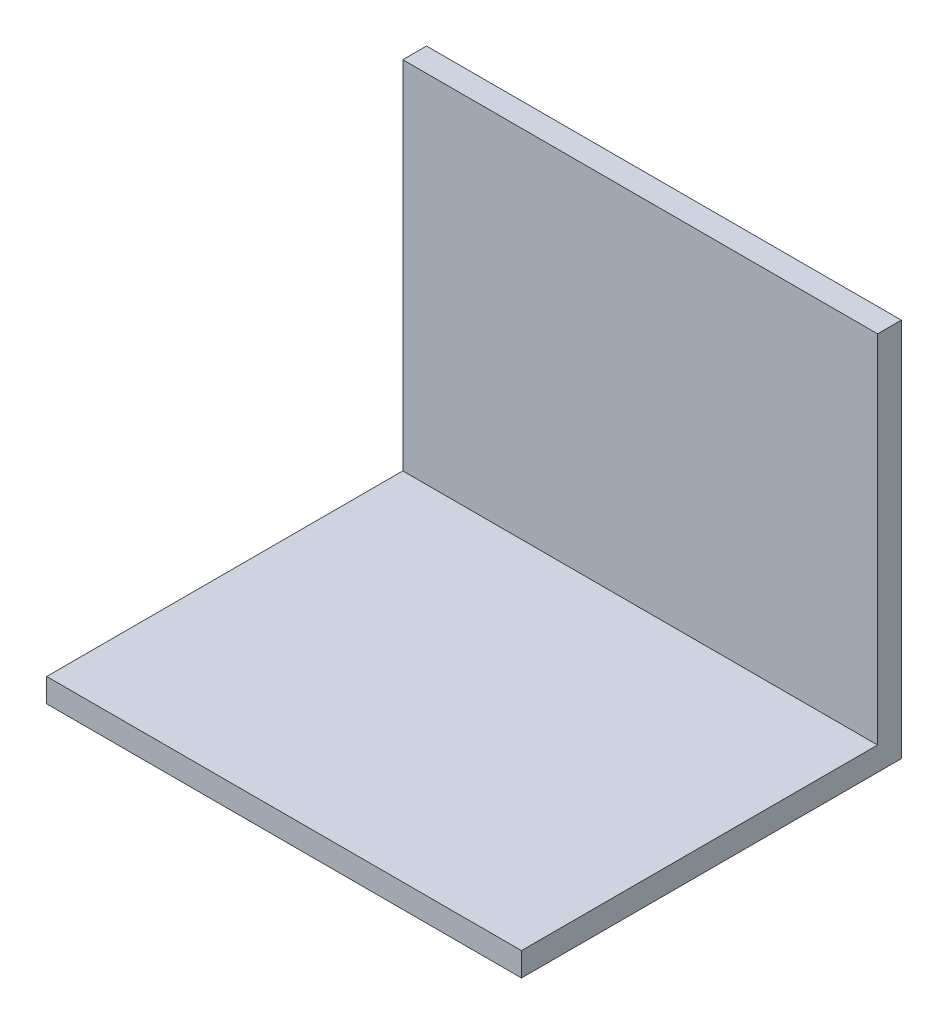
from build123d import *

# Parameters (mm, degrees)
BOSS_EXTRUDE1_DEPTH = 63.5


with BuildPart() as part:
    # Sketch1 → Boss-Extrude1 (new body)
    with BuildSketch(Plane(origin=(0, 0, 0), x_dir=(0, 0, -1), z_dir=(1, 0, 0))):
        Polygon((-3.175, 0), (-50.8, 0), (-50.8, -3.175), (0, -3.175), (0, 0), (0, 47.625), (-3.175, 47.625), align=None)
    extrude(amount=BOSS_EXTRUDE1_DEPTH)


solid = part.part
